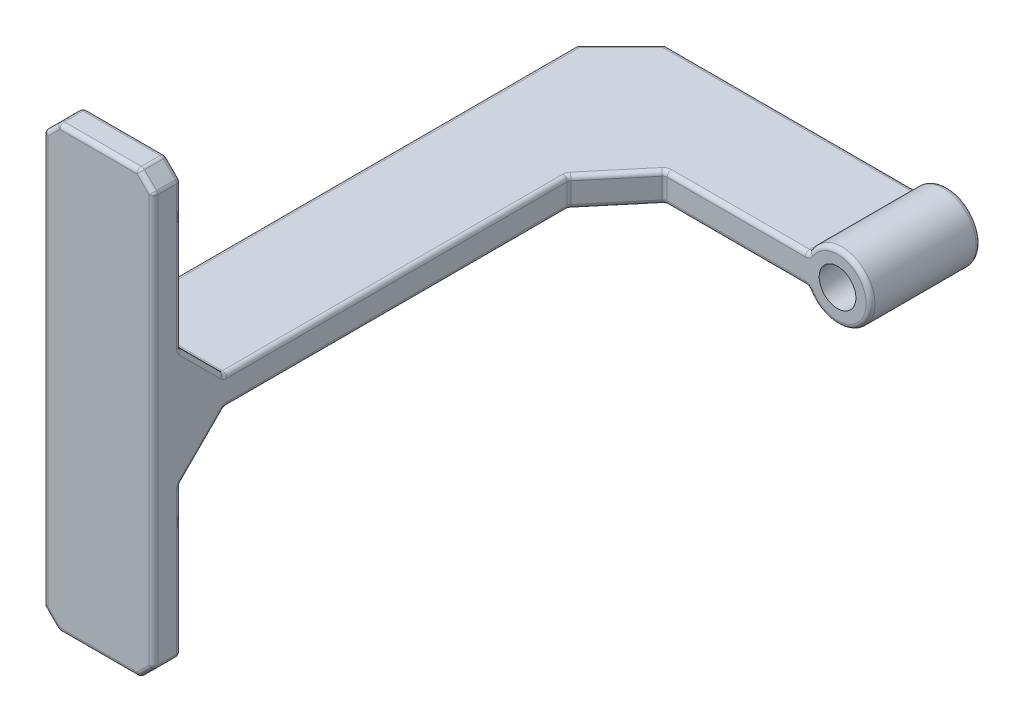
from build123d import *

# Parameters (mm, degrees)
BOSS_EXTRUDE1_DEPTH      = 2.54
BOSS_EXTRUDE1_DEPTH_BACK = 2.54
SKETCH2_W                = 19.05
SKETCH2_H                = 76.2
BOSS_EXTRUDE2_DEPTH      = 4.7625
CHAMFER1_SIZE            = 7.62
SKETCH3_W                = 2.54
SKETCH3_H                = 19.05
BOSS_EXTRUDE3_REACH      = 116.476
SKETCH4_W                = 19.05
SKETCH4_H                = 5.08
CHAMFER2_SIZE            = 7.62
CHAMFER3_SIZE            = 7.62
CHAMFER3_SIZE2           = 9.081162376
CHAMFER4_SIZE            = 2.54
FILLET2_R                = 0.762


with BuildPart() as part:
    # Sketch1 → Boss-Extrude1 (new, two sides: drawn at the far end of the back side and taken through both)
    with BuildSketch(Plane(origin=(0, 0, 0), x_dir=(1, 0, 0), z_dir=(0, 1, 0)).offset(-BOSS_EXTRUDE1_DEPTH_BACK)):
        Polygon((-25.719899244, 0), (-25.719899244, 95.25), (25.080100756, 95.25), (25.080100756, 76.2), (-6.669899244, 76.2), (-6.669899244, 0), align=None)
    extrude(amount=BOSS_EXTRUDE1_DEPTH + BOSS_EXTRUDE1_DEPTH_BACK)

    # Sketch2 → Boss-Extrude2 (add)
    with BuildSketch(Plane.XY):
        with Locations((-16.194899244, 0)):
            Rectangle(SKETCH2_W, SKETCH2_H)
    extrude(amount=BOSS_EXTRUDE2_DEPTH)

    # Chamfer1
    chamfer1_edges = [part.edges().sort_by_distance(p)[0] for p in [
        (-16.194899244, 2.54, 0),
        (-16.194899244, -2.54, 0),
    ]]
    chamfer(chamfer1_edges, length=CHAMFER1_SIZE)


with BuildPart() as body_2:
    # Sketch3 → Revolve1 (revolve)
    with BuildSketch(Plane(origin=(0, 0, 0), x_dir=(1, 0, 0), z_dir=(0, 1, 0))):
        with Locations((26.350100756, 85.725)):
            Rectangle(SKETCH3_W, SKETCH3_H)
    revolve(axis=Axis((30.795100756, 0, -76.2), (0, 0, -1)))

    # Boss-Extrude3: up to this face of the body
    boss_extrude3_end = body_2.part.faces().sort_by_distance((36.510100756, 0, -85.725))[0]
    # Sketch4 → Boss-Extrude3 (add, up to the picked face)
    with BuildSketch(Plane(origin=(25.080100756, 0, 0), x_dir=(0, 0, -1), z_dir=(1, 0, 0)), mode=Mode.PRIVATE) as boss_extrude3_sk1:
        with Locations((85.725, 0)):
            Rectangle(SKETCH4_W, SKETCH4_H)
    boss_extrude3_tool1 = split(extrude(boss_extrude3_sk1.sketch, amount=BOSS_EXTRUDE3_REACH, mode=Mode.PRIVATE), bisect_by=boss_extrude3_end, keep=Keep.BOTH, mode=Mode.PRIVATE)

    add(part.part)  # Boss-Extrude3 merges part
    add(boss_extrude3_tool1.solids().sort_by(Axis((25.080101, 0, -85.725), (1, 0, 0)))[0])
    add(boss_extrude3_tool1.solids().sort_by(Axis((25.080101, 0, -85.725), (1, 0, 0)))[1])

    # Chamfer2
    chamfer2_edges = [body_2.edges().sort_by_distance(p)[0] for p in [
        (-25.719899244, 0, -95.25),
    ]]
    chamfer(chamfer2_edges, length=CHAMFER2_SIZE)

    # Chamfer3
    chamfer3_edges = [body_2.edges().sort_by_distance(p)[0] for p in [
        (-6.669899244, 0, -76.2),
    ]]
    chamfer3_side = [body_2.faces().sort_by_distance(p)[0] for p in [
        (15.840197077, 0, -76.2),
    ]]
    chamfer(chamfer3_edges, length=CHAMFER3_SIZE, length2=CHAMFER3_SIZE2, reference=chamfer3_side[0])

    # Chamfer4
    chamfer4_edges = [body_2.edges().sort_by_distance(p)[0] for p in [
        (-6.669899244, 38.1, 2.38125),
        (-25.719899244, 38.1, 2.38125),
        (-25.719899244, -38.1, 2.38125),
        (-6.669899244, -38.1, 2.38125),
    ]]
    chamfer(chamfer4_edges, length=CHAMFER4_SIZE)

    # Fillet2
    fillet2_edges = [body_2.edges().sort_by_distance(p)[0] for p in [
        (-9.209899244, -38.1, 2.38125),
        (-7.939899244, -36.83, 4.7625),
        (-16.194899244, -38.1, 4.7625),
        (-16.194899244, -38.1, 0),
        (-23.179899244, -38.1, 2.38125),
        (-6.669899244, -35.56, 2.38125),
        (-7.939899244, -36.83, 0),
        (-7.939899244, 36.83, 4.7625),
        (-6.669899244, 0, 4.7625),
        (-24.449899244, -36.83, 4.7625),
        (-16.194899244, 38.1, 4.7625),
        (-9.209899244, 38.1, 2.38125),
        (-25.719899244, -35.56, 2.38125),
        (-24.449899244, -36.83, 0),
        (-6.669899244, -22.86, 0),
        (-6.669899244, 35.56, 2.38125),
        (-7.939899244, 36.83, 0),
        (-25.719899244, 0, 4.7625),
        (-24.449899244, 36.83, 4.7625),
        (-23.179899244, 38.1, 2.38125),
        (-16.194899244, 38.1, 0),
        (-16.194899244, -10.16, 0),
        (-25.719899244, -22.86, 0),
        (-6.669899244, -6.35, -3.81),
        (-6.669899244, 22.86, 0),
        (-25.719899244, 35.56, 2.38125),
        (-24.449899244, 36.83, 0),
        (-6.669899244, -2.54, -37.369418812),
        (-25.719899244, -6.35, -3.81),
        (-16.194899244, -2.54, -7.62),
        (-6.669899244, 6.35, -3.81),
        (-16.194899244, 10.16, 0),
        (-25.719899244, 22.86, 0),
        (-6.669899244, 2.54, -37.369418812),
        (-6.669899244, 0, -67.118837624),
        (-2.859899244, -2.54, -71.659418812),
        (-25.719899244, -2.54, -47.625),
        (-16.194899244, 2.54, -7.62),
        (-25.719899244, 6.35, -3.81),
        (0.950100756, 0, -76.2),
        (-2.859899244, 2.54, -71.659418812),
        (13.312833921, -2.54, -76.2),
        (-21.909899244, -2.54, -91.44),
        (-25.719899244, 0, -87.63),
        (-25.719899244, 2.54, -47.625),
        (36.510100756, 0, -76.2),
        (13.312833921, 2.54, -76.2),
        (25.675567085, -2.54, -85.725),
        (3.787833921, -2.54, -95.25),
        (-18.099899244, 0, -95.25),
        (-21.909899244, 2.54, -91.44),
        (25.675567085, 2.54, -85.725),
        (36.510100756, 0, -95.25),
        (3.787833921, 2.54, -95.25),
    ]]
    fillet(fillet2_edges, radius=FILLET2_R)


solid = body_2.part
